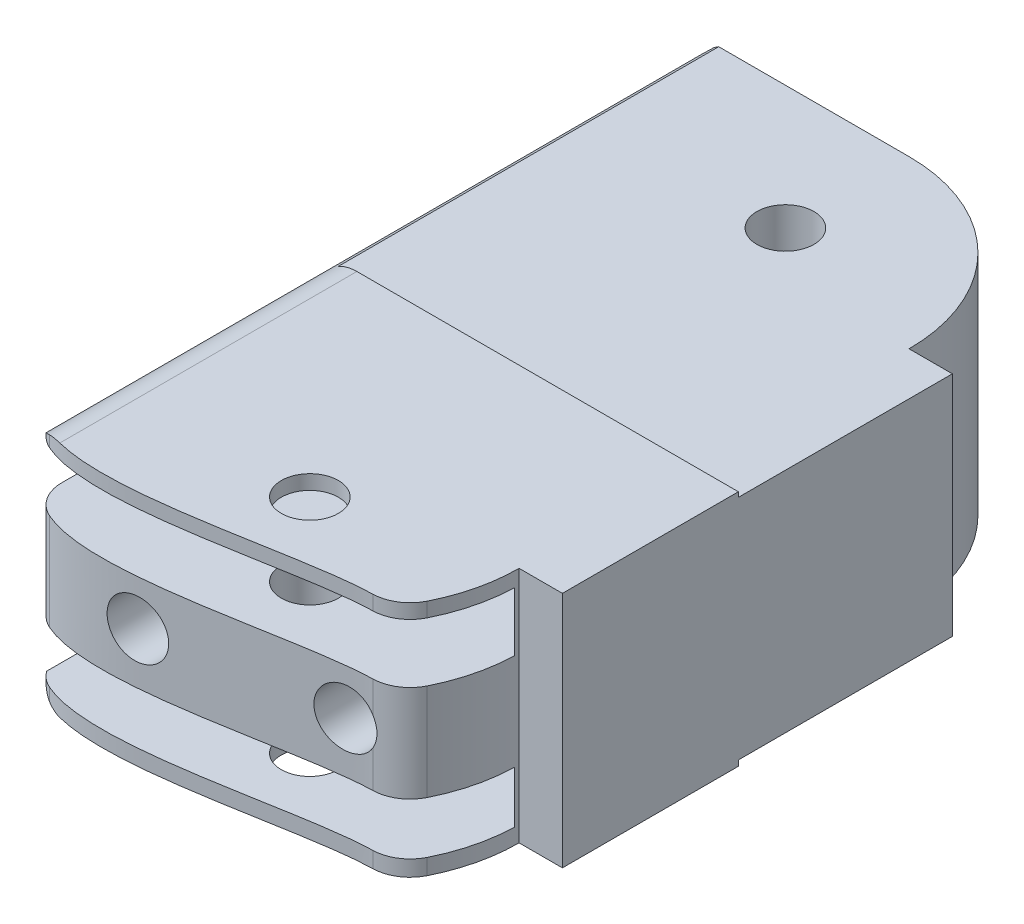
from build123d import *

# Parameters (mm, degrees)
SKETCH1_W               = 22.054431489
SKETCH1_H               = 12.5
BOSS_EXTRUDE1_DEPTH     = 40
CUT_EXTRUDE1_DEPTH      = 10
CUT_EXTRUDE1_DEPTH_BACK = 15
SKETCH2_R               = 1.5
FILLET3_R               = 2
SKETCH5_R               = 1.5
CUT_EXTRUDE4_DEPTH      = 53.86644408
SKETCH16_W              = 22.16406654
SKETCH16_H              = 3.097743049
SKETCH16_W_2            = 22.194630718
SKETCH16_H_2            = 2.724396189
CUT_EXTRUDE6_DEPTH      = 8.5
FILLET4_R               = 2
SKETCH17_W              = 17.85596127
SKETCH17_H              = 3.097743049
SKETCH17_H_2            = 2.724396189
CUT_EXTRUDE7_DEPTH      = 5
SKETCH18_W              = 23.758682738
SKETCH18_H              = 0.759330362
SKETCH18_W_2            = 23.717859304
SKETCH18_H_2            = 0.728261761
CUT_EXTRUDE8_DEPTH      = 20


with BuildPart() as part:
    # Sketch1 → Boss-Extrude1 (new body)
    with BuildSketch(Plane.XY):
        with Locations((-13.228930986, -24.070183414)):
            Rectangle(SKETCH1_W, SKETCH1_H)
    extrude(amount=BOSS_EXTRUDE1_DEPTH)

    # Sketch2 → Cut-Extrude1 (cut, two sides: drawn at the far end of the back side and taken through both)
    with BuildSketch(Plane.XZ.offset(30.320183414).offset(-CUT_EXTRUDE1_DEPTH_BACK)):
        with Locations(Location((-13.228930986, 6.5, 0), (0, 0, 90))):
            Circle(SKETCH2_R)
        with Locations(Location((-13.228930986, 31.5, 0), (0, 0, 90))):
            Circle(SKETCH2_R)
        with BuildLine():
            Line((-4.478930986, 29.25), (-2.201715242, 29.25))
            add(Edge.make_bspline(
                [(-24.256146731, 29.25), (-34.277912729, 38.417119108), (-13.227499763, 50.308047167), (7.840407292, 38.416977249), (-2.201715242, 29.25)],
                knots=[0, 0, 0, 0, 0.49986218, 1, 1, 1, 1], degree=3))
            add(Edge.make_bspline(
                [(-6.103895584, 34.329012749), (-10.720559386, 33.527203043), (-28.641384523, 40.845191705), (-24.256146731, 29.25)],
                knots=[0, 0, 0, 0, 1, 1, 1, 1], degree=3))
            ThreePointArc((-6.103895584, 34.329012749), (-4.895067543, 31.916312081), (-4.478930986, 29.25))
        make_face()
        with BuildLine():
            Line((-4.478930986, 8.75), (-2.201715242, 8.75))
            add(Edge.make_bspline(
                [(-2.201715242, 8.75), (5.39210746, 3.880294823), (-0.777052631, -4.523329032), (-17.174300591, -10.623347238), (-34.821400648, -0.026005424), (-24.256146731, 8.75)],
                knots=[0, 0, 0, 0, 0.283272691, 0.504244858, 1, 1, 1, 1], degree=3))
            add(Edge.make_bspline(
                [(-23.490579314, 0), (-24.966512963, 4.237786421), (-24.256146731, 8.75)],
                knots=[0, 0, 0, 1, 1, 1], degree=2))
            Line((-23.490579314, 0), (-13.228930986, 0))
            ThreePointArc((-13.228930986, 0), (-7.041746651, 2.562815665), (-4.478930986, 8.75))
        make_face()
    extrude(amount=CUT_EXTRUDE1_DEPTH + CUT_EXTRUDE1_DEPTH_BACK, mode=Mode.SUBTRACT)

    # Fillet3
    # the kernel refuses this fillet: 2 mm, written as the material it takes off along each edge
    with BuildSketch(Plane(origin=(-24.256146731, -17.820183414, -5.498495188), x_dir=(1, 0, 0), z_dir=(0, 0, 1))) as fillet3_piece_1:
        with BuildLine():
            CenterArc((FILLET3_R, -FILLET3_R), FILLET3_R, 90, 90)
            Line((0, -FILLET3_R), (-FILLET3_R * 0.02, -FILLET3_R))
            Line((-FILLET3_R * 0.02, -FILLET3_R), (-FILLET3_R * 0.02, FILLET3_R * 0.02))
            Line((-FILLET3_R * 0.02, FILLET3_R * 0.02), (FILLET3_R, FILLET3_R * 0.02))
            Line((FILLET3_R, FILLET3_R * 0.02), (FILLET3_R, 0))
        make_face()
    extrude(amount=44.984872581, mode=Mode.SUBTRACT)
    with BuildSketch(Plane(origin=(-24.256146731, -30.320183414, -5.498495188), x_dir=(1, 0, 0), z_dir=(0, 0, 1))) as fillet3_piece_2:
        with BuildLine():
            CenterArc((FILLET3_R, FILLET3_R), FILLET3_R, 180, 90)
            Line((0, FILLET3_R), (-FILLET3_R * 0.02, FILLET3_R))
            Line((-FILLET3_R * 0.02, FILLET3_R), (-FILLET3_R * 0.02, -FILLET3_R * 0.02))
            Line((-FILLET3_R * 0.02, -FILLET3_R * 0.02), (FILLET3_R, -FILLET3_R * 0.02))
            Line((FILLET3_R, -FILLET3_R * 0.02), (FILLET3_R, 0))
        make_face()
    extrude(amount=44.984872581, mode=Mode.SUBTRACT)
    with BuildSketch(Plane(origin=(-24.256146731, -17.374523396, 3.001504812), x_dir=(0.16676818592575848, -1.2260366807919533e-15, -0.9859961319209278), z_dir=(0, -1, 0))) as fillet3_piece_3:
        with BuildLine():
            CenterArc((0.168096911, 1.999974157), FILLET3_R, 260.400032587, 9.891234523)
            Line((-0.165439461, 0.027981894), (-0.172110188, -0.011457952))
            Line((-0.172110188, -0.011457952), (-0.006670727, -0.039439845))
            Line((-0.006670727, -0.039439845), (-0.00020343, -0.039999483))
            ThreePointArc((-0.00020343, -0.039999483), (0.089132026, -0.040226606), (0.178467349, -0.039999483))
            Line((0.178467349, -0.039999483), (0.178264007, 0))
        make_face()
    extrude(amount=13.391320036, mode=Mode.SUBTRACT)
    with BuildSketch(Plane(origin=(-24.256146731, -14.125185169, 34.486377393), x_dir=(0.8125654725304995, 0, 0.5828699279009736), z_dir=(0, -1, 0))) as fillet3_piece_4:
        with BuildLine():
            CenterArc((1.058597408, -1.955531144), FILLET3_R, 77.895172565, 66.452175148)
            Line((-0.566533537, -0.789791288), (-0.599036156, -0.766476491))
            Line((-0.599036156, -0.766476491), (-0.032502619, 0.023314797))
            Line((-0.032502619, 0.023314797), (-0.009827922, 0.038773856))
            ThreePointArc((-0.009827922, 0.038773856), (0.740246051, 0.125750941), (1.486387336, 0.039110623))
            Line((1.486387336, 0.039110623), (1.477999298, 0))
        make_face()
    extrude(amount=19.88999649, mode=Mode.SUBTRACT)

    # Sketch5 → Cut-Extrude4 (cut, through all)
    with BuildSketch(Plane.XY):
        with Locations(Location((-18.011106811, -24.070183414, 0), (0, 0, 180))):
            Circle(SKETCH5_R)
        with Locations(Location((-8.446755162, -24.070183414, 0), (0, 0, 180))):
            Circle(SKETCH5_R)
    extrude(amount=CUT_EXTRUDE4_DEPTH, mode=Mode.SUBTRACT)

    # Sketch16 → Cut-Extrude6 (cut)
    with BuildSketch(Plane.XY.offset(38)):
        with Locations((-13.228930985, -20.132105575)):
            Rectangle(SKETCH16_W, SKETCH16_H)
        with Locations((-13.228930985, -28.124114993)):
            Rectangle(SKETCH16_W_2, SKETCH16_H_2)
    extrude(amount=-CUT_EXTRUDE6_DEPTH, mode=Mode.SUBTRACT)

    # Fillet4
    # the kernel refuses this fillet: 2 mm, written as the material it takes off along each edge
    with BuildSketch(Plane(origin=(-6.103895584, -21.985936801, 34.329012749), x_dir=(0.5153680546007453, 0, -0.8569689424343471), z_dir=(0, 1, 0))) as fillet4_piece_1:
        with BuildLine():
            CenterArc((1.205528974, 1.993941708), FILLET4_R, 212.228268917, 62.232476225)
            Line((-0.486331325, 0.927354287), (-0.520168531, 0.906022538))
            ThreePointArc((-0.520168531, 0.906022538), (-0.25689069, 0.456334761), (-0.037300681, -0.01444504))
            Line((-0.037300681, -0.01444504), (-0.003111043, -0.039878834))
            ThreePointArc((-0.003111043, -0.039878834), (0.68054055, -0.066505026), (1.364192143, -0.039878834))
            Line((1.364192143, -0.039878834), (1.3610811, 0))
        make_face()
    extrude(amount=7.568456138, mode=Mode.SUBTRACT)
    with BuildSketch(Plane(origin=(-6.103895584, -30.164619649, 34.329012749), x_dir=(0.5153680546007453, 0, -0.8569689424343471), z_dir=(0, 1, 0))) as fillet4_piece_2:
        with BuildLine():
            CenterArc((1.205528974, 1.993941708), FILLET4_R, 212.228268917, 62.232476225)
            Line((-0.486331325, 0.927354287), (-0.520168531, 0.906022538))
            ThreePointArc((-0.520168531, 0.906022538), (-0.25689069, 0.456334761), (-0.037300681, -0.01444504))
            Line((-0.037300681, -0.01444504), (-0.003111043, -0.039878834))
            ThreePointArc((-0.003111043, -0.039878834), (0.68054055, -0.066505026), (1.364192143, -0.039878834))
            Line((1.364192143, -0.039878834), (1.3610811, 0))
        make_face()
    extrude(amount=11.886345299, mode=Mode.SUBTRACT)
    with BuildSketch(Plane(origin=(-6.103895584, -33.722886164, 34.329012749), x_dir=(0.5153680546007453, 0, -0.8569689424343471), z_dir=(0, 1, 0))) as fillet4_piece_3:
        with BuildLine():
            CenterArc((1.205528974, 1.993941708), FILLET4_R, 212.228268917, 62.232476225)
            Line((-0.486331325, 0.927354287), (-0.520168531, 0.906022538))
            ThreePointArc((-0.520168531, 0.906022538), (-0.25689069, 0.456334761), (-0.037300681, -0.01444504))
            Line((-0.037300681, -0.01444504), (-0.003111043, -0.039878834))
            ThreePointArc((-0.003111043, -0.039878834), (0.68054055, -0.066505026), (1.364192143, -0.039878834))
            Line((1.364192143, -0.039878834), (1.3610811, 0))
        make_face()
    extrude(amount=7.639275828, mode=Mode.SUBTRACT)

    # Sketch17 → Cut-Extrude7 (cut)
    with BuildSketch(Plane.XY.offset(29.5)):
        with Locations((-13.410483779, -20.132105575)):
            Rectangle(SKETCH17_W, SKETCH17_H)
        with Locations((-13.410483779, -28.124114993)):
            Rectangle(SKETCH17_W, SKETCH17_H_2)
    extrude(amount=-CUT_EXTRUDE7_DEPTH, mode=Mode.SUBTRACT)

    # Sketch18 → Cut-Extrude8 (cut)
    with BuildSketch(Plane.XY):
        with Locations((-13.209901434, -17.695854471)):
            Rectangle(SKETCH18_W, SKETCH18_H)
        with Locations((-13.189489717, -30.396128596)):
            Rectangle(SKETCH18_W_2, SKETCH18_H_2)
    extrude(amount=CUT_EXTRUDE8_DEPTH, mode=Mode.SUBTRACT)


solid = part.part
